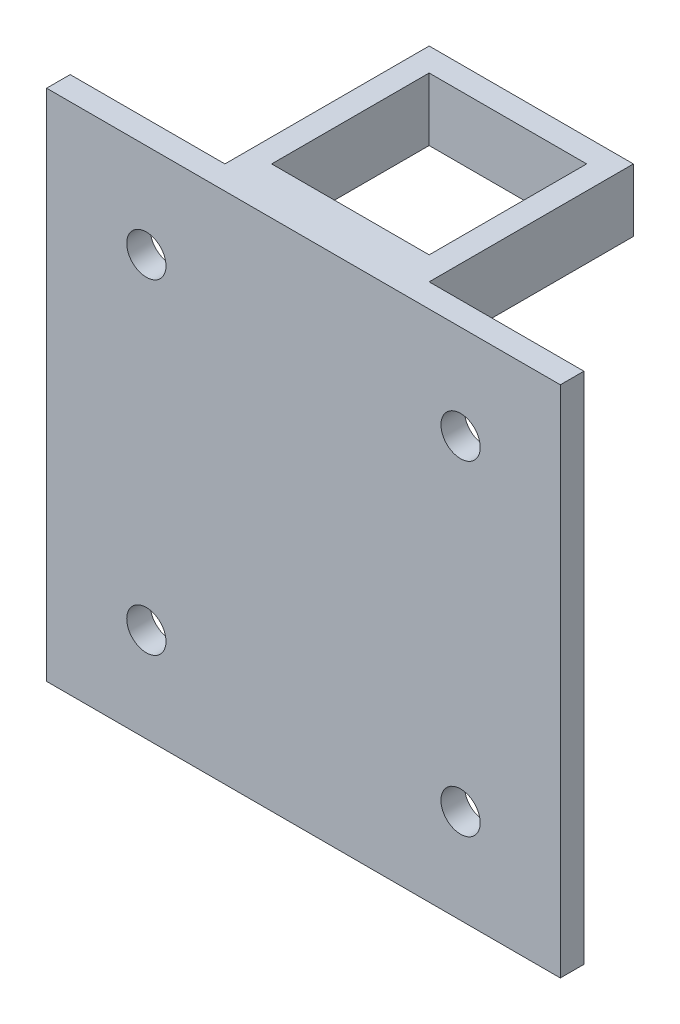
from build123d import *

# Parameters (mm, degrees)
SKETCH_1_W            = 65.4
SKETCH_1_H            = 65.4
SKETCH_1_R            = 2.5
EXTRUDE_436_DEPTH     = 3
SKETCH_2_W            = 26
SKETCH_2_H            = 8
EXTRUDE_671_DEPTH     = 26
SKETCH_3_W            = 20.05
SKETCH_3_H            = 20.05
CUT_EXTRUDE_878_DEPTH = 91.818059878
SKETCH_4_R            = 5
SKETCH_4_R_2          = 2
EXTRUDE_1159_DEPTH    = 6.6
SKETCH_5_R            = 2.4
EXTRUDE_1_DEPTH       = 16


with BuildPart() as part:
    # Эскиз1 → Extrude 436 (new body)
    with BuildSketch(Plane.XY):
        with Locations((-32.7, 32.7)):
            Rectangle(SKETCH_1_W, SKETCH_1_H)
        with Locations((-52.7, 53.4)):
            Circle(SKETCH_1_R, mode=Mode.SUBTRACT)
        with Locations((-12.7, 53.4)):
            Circle(SKETCH_1_R, mode=Mode.SUBTRACT)
        with Locations((-12.7, 12)):
            Circle(SKETCH_1_R, mode=Mode.SUBTRACT)
        with Locations((-52.7, 12)):
            Circle(SKETCH_1_R, mode=Mode.SUBTRACT)
    extrude(amount=EXTRUDE_436_DEPTH)

    # Эскиз2 → Extrude 671 (add)
    with BuildSketch(Plane(origin=(0, 0, 0), x_dir=(-1, 0, 0), z_dir=(0, 0, -1))):
        with Locations((32.7, 61.4)):
            Rectangle(SKETCH_2_W, SKETCH_2_H)
    extrude(amount=EXTRUDE_671_DEPTH)

    # Эскиз3 → Cut-Extrude 878 (cut, through all)
    with BuildSketch(Plane.XZ.offset(-57.4)):
        with Locations((-32.7, -13)):
            Rectangle(SKETCH_3_W, SKETCH_3_H)
    extrude(amount=-CUT_EXTRUDE_878_DEPTH, mode=Mode.SUBTRACT)

    # Эскиз4 → Extrude 1159 (add)
    with BuildSketch(Plane(origin=(0, 0, 0), x_dir=(-1, 0, 0), z_dir=(0, 0, -1))):
        with Locations((12.7, 32.7)):
            Circle(SKETCH_4_R)
        with Locations((12.7, 32.7)):
            Circle(SKETCH_4_R_2, mode=Mode.SUBTRACT)
    extrude(amount=EXTRUDE_1159_DEPTH)

    # Эскиз5 → Бобышка-Вытянуть1 (add)
    with BuildSketch(Plane(origin=(0, 0, 0), x_dir=(-1, 0, 0), z_dir=(0, 0, -1))):
        with Locations((52.7, 32.7)):
            Circle(SKETCH_5_R)
    extrude(amount=EXTRUDE_1_DEPTH)


solid = part.part
